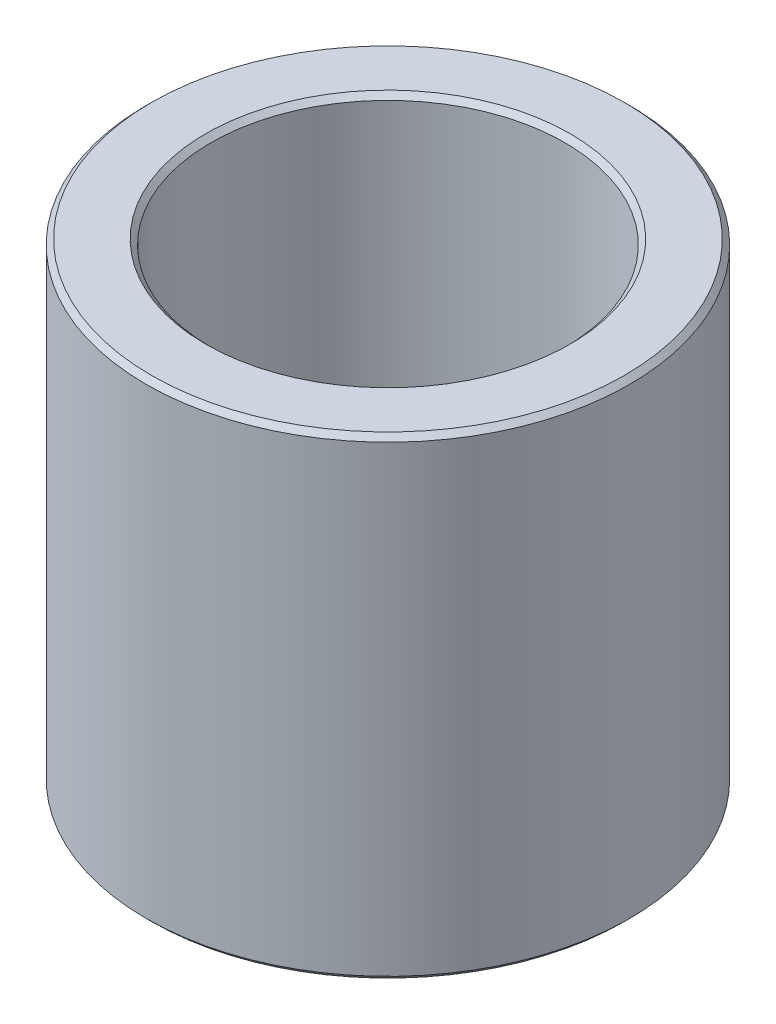
from build123d import *
from OCP.BRepFilletAPI import BRepFilletAPI_MakeChamfer

# Parameters (mm, degrees)
SKETCH1_R           = 32.5
BOSS_EXTRUDE1_DEPTH = 63.607411149
SKETCH2_R           = 23.815414931
CUT_EXTRUDE1_DEPTH  = 79.475491417
CHAMFER1_SIZE       = 0.69891071
CHAMFER1_SIZE2      = 0.701009985


with BuildPart() as part:
    # Sketch1 → Boss-Extrude1 (new body)
    with BuildSketch(Plane(origin=(0, 0, 0), x_dir=(1, 0, 0), z_dir=(0, 1, 0))):
        Circle(SKETCH1_R)
    extrude(amount=BOSS_EXTRUDE1_DEPTH)

    # Sketch2 → Cut-Extrude1 (cut, through all)
    with BuildSketch(Plane(origin=(0, 0, 0), x_dir=(1, 0, 0), z_dir=(0, 1, 0))):
        Circle(SKETCH2_R)
    extrude(amount=CUT_EXTRUDE1_DEPTH, mode=Mode.SUBTRACT)

    # Chamfer1: one chamfer whose edges measure the first distance from different faces: ONE call of the kernel's chamfer builder (chamfer() names one face for all edges)
    chamfer1_edges_1 = [part.edges().sort_by_distance(p)[0] for p in [
        (-23.815414931, 63.607411149, 0),
    ]]
    chamfer1_side_1 = [part.faces().sort_by_distance(p)[0] for p in [
        (-31.580761184, 63.607411149, 0),
    ]]
    chamfer1_edges_2 = [part.edges().sort_by_distance(p)[0] for p in [
        (-23.815414931, 0, 0),
    ]]
    chamfer1_side_2 = [part.faces().sort_by_distance(p)[0] for p in [
        (-23.815414931, 31.803705575, 0),
    ]]
    chamfer1_edges_3 = [part.edges().sort_by_distance(p)[0] for p in [
        (-32.5, 0, 0),
    ]]
    chamfer1_side_3 = [part.faces().sort_by_distance(p)[0] for p in [
        (-31.580761184, 0, 0),
    ]]
    chamfer1_edges_4 = [part.edges().sort_by_distance(p)[0] for p in [
        (-32.5, 63.607411149, 0),
    ]]
    chamfer1_side_4 = [part.faces().sort_by_distance(p)[0] for p in [
        (-32.5, 31.803705575, 0),
    ]]
    chamfer1 = BRepFilletAPI_MakeChamfer(part.part.solid().wrapped)
    for e in chamfer1_edges_1:
        chamfer1.Add(CHAMFER1_SIZE, CHAMFER1_SIZE2, e.wrapped, chamfer1_side_1[0].wrapped)  # the first distance lies on this face
    for e in chamfer1_edges_2:
        chamfer1.Add(CHAMFER1_SIZE, CHAMFER1_SIZE2, e.wrapped, chamfer1_side_2[0].wrapped)  # the first distance lies on this face
    for e in chamfer1_edges_3:
        chamfer1.Add(CHAMFER1_SIZE, CHAMFER1_SIZE2, e.wrapped, chamfer1_side_3[0].wrapped)  # the first distance lies on this face
    for e in chamfer1_edges_4:
        chamfer1.Add(CHAMFER1_SIZE, CHAMFER1_SIZE2, e.wrapped, chamfer1_side_4[0].wrapped)  # the first distance lies on this face
    add(Compound.cast(chamfer1.Shape()), mode=Mode.REPLACE)


solid = part.part
